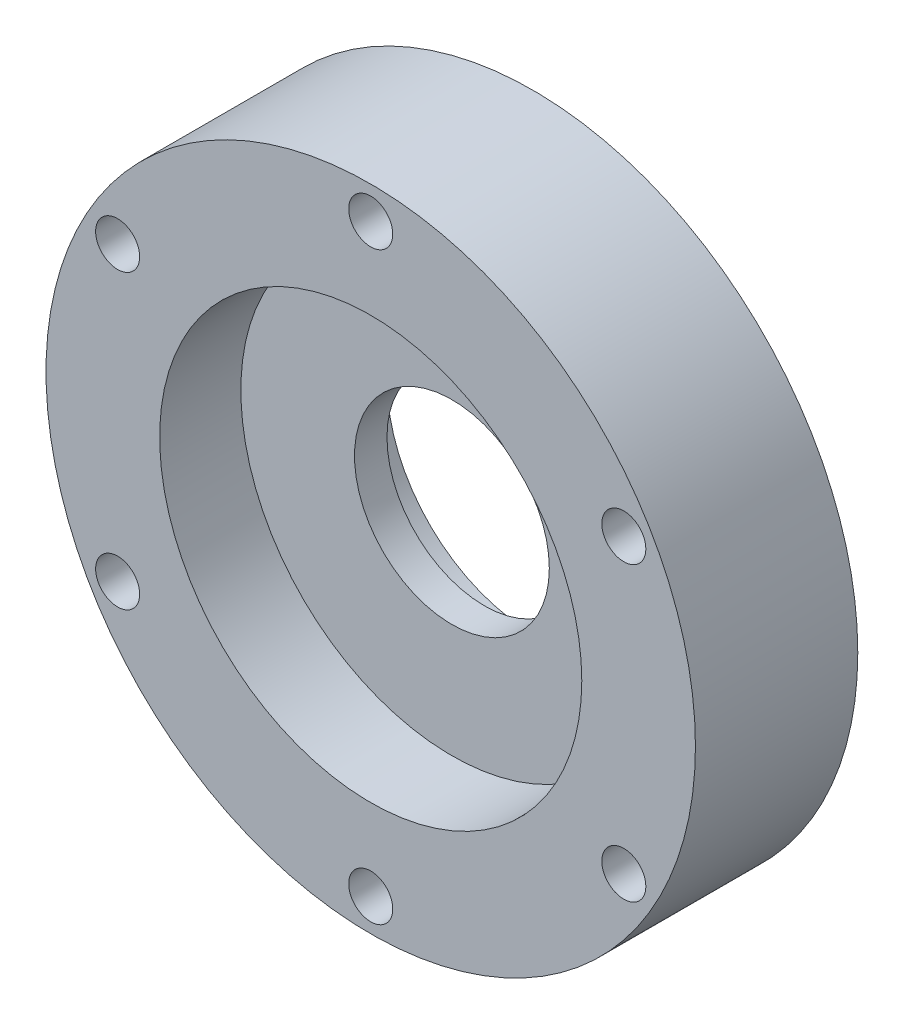
from build123d import *

# Parameters (mm, degrees)
SKETCH1_R             = 31.75
BOSS_EXTRUDE1_DEPTH   = 15.875
SKETCH2_R             = 20.6375
CUT_EXTRUDE1_DEPTH    = 7.9375
SKETCH3_R             = 14.2875
CUT_EXTRUDE2_DEPTH    = 4.7625
SKETCH4_R             = 9.525
CUT_EXTRUDE3_DEPTH    = 46.597466007
F_8_CLEARANCE_HOLE1_D = 4.3053
CUT_EXTRUDE4_DEPTH    = 12.7
CIRPATTERN1_COUNT     = 6
CUT_EXTRUDE5_DEPTH    = 4.7625
CIRPATTERN2_COUNT     = 6


with BuildPart() as part:
    # Sketch1 → Boss-Extrude1 (new body)
    with BuildSketch(Plane.XY):
        Circle(SKETCH1_R)
    extrude(amount=BOSS_EXTRUDE1_DEPTH)

    # Sketch2 → Cut-Extrude1 (cut)
    with BuildSketch(Plane.XY.offset(15.875)):
        Circle(SKETCH2_R)
    extrude(amount=-CUT_EXTRUDE1_DEPTH, mode=Mode.SUBTRACT)

    # Sketch3 → Cut-Extrude2 (cut)
    with BuildSketch(Plane(origin=(0, 0, 0), x_dir=(-1, 0, 0), z_dir=(0, 0, -1))):
        Circle(SKETCH3_R)
    extrude(amount=-CUT_EXTRUDE2_DEPTH, mode=Mode.SUBTRACT)

    # Sketch4 → Cut-Extrude3 (cut, through all)
    with BuildSketch(Plane.XY.offset(7.9375)):
        Circle(SKETCH4_R)
    extrude(amount=-CUT_EXTRUDE3_DEPTH, mode=Mode.SUBTRACT)

    # #8 Clearance Hole1 (through all)
    with Locations(Plane.XY.offset(15.875)):
        with Locations((0, 28.575), (24.746675913, 14.2875), (24.746675913, -14.2875), (0, -28.575), (-24.746675913, -14.2875), (-24.746675913, 14.2875)):
            Hole(F_8_CLEARANCE_HOLE1_D / 2)

    # Sketch8 → Cut-Extrude4 (cut)
    with BuildSketch(Plane(origin=(0, 0, 0), x_dir=(-1, 0, 0), z_dir=(0, 0, -1))):
        with BuildLine():
            ThreePointArc((1.583266667, 25.822929568), (1.000695836, 25.241701981), (0.7874, 24.446894352))
            Line((0.7874, 24.446894352), (0.7874, 23.693775686))
            ThreePointArc((0.7874, 23.693775686), (1.197721204, 22.628690556), (2.216573333, 22.11419064))
            ThreePointArc((2.216573333, 22.11419064), (11.1125, 19.247414599), (18.043164212, 12.976704136))
            ThreePointArc((18.043164212, 12.976704136), (18.998160274, 12.351602268), (20.125711655, 12.528796246))
            Line((20.125711655, 12.528796246), (20.777931553, 12.905355579))
            ThreePointArc((20.777931553, 12.905355579), (21.359607232, 13.487479006), (21.571679673, 14.282613938))
            ThreePointArc((21.571679673, 14.282613938), (21.932102472, 15.756785998), (22.935561781, 16.895275029))
            ThreePointArc((22.935561781, 16.895275029), (23.602704974, 17.982898478), (23.253893866, 19.210227129))
            ThreePointArc((23.253893866, 19.210227129), (15.08125, 26.121491242), (5.009597773, 29.743576389))
            ThreePointArc((5.009597773, 29.743576389), (3.772294429, 29.431991344), (3.163956488, 28.310416667))
            ThreePointArc((3.163956488, 28.310416667), (2.679725721, 26.872150898), (1.583266667, 25.822929568))
        make_face()
    cut_extrude4 = extrude(amount=-CUT_EXTRUDE4_DEPTH, mode=Mode.SUBTRACT)

    # CirPattern1: Cut-Extrude4 ×6 about axis
    cirpattern1_axis = Axis((0, 0, 0), (0, 0, 1))
    for i in range(1, CIRPATTERN1_COUNT):
        add(cut_extrude4.rotate(cirpattern1_axis, i * 360 / CIRPATTERN1_COUNT), mode=Mode.SUBTRACT)

    # Sketch9 → Cut-Extrude5 (cut)
    with BuildSketch(Plane(origin=(0, 0, 0), x_dir=(-1, 0, 0), z_dir=(0, 0, -1))):
        with BuildLine():
            ThreePointArc((1.583266667, 25.822929568), (1.000695836, 25.241701981), (0.7874, 24.446894352))
            Line((0.7874, 24.446894352), (0.7874, 17.300253069))
            ThreePointArc((0.7874, 17.300253069), (1.178468326, 16.256841597), (2.159, 15.72750279))
            ThreePointArc((2.159, 15.72750279), (7.9375, 13.748153285), (12.540916954, 9.733500242))
            ThreePointArc((12.540916954, 9.733500242), (13.489603645, 9.149004306), (14.588758649, 9.332034937))
            Line((14.588758649, 9.332034937), (20.777931553, 12.905355579))
            ThreePointArc((20.777931553, 12.905355579), (21.359607232, 13.487479006), (21.571679673, 14.282613938))
            ThreePointArc((21.571679673, 14.282613938), (21.932102472, 15.756785998), (22.935561781, 16.895275029))
            ThreePointArc((22.935561781, 16.895275029), (23.602704974, 17.982898478), (23.253893866, 19.210227129))
            ThreePointArc((23.253893866, 19.210227129), (15.08125, 26.121491242), (5.009597773, 29.743576389))
            ThreePointArc((5.009597773, 29.743576389), (3.772294429, 29.431991344), (3.163956488, 28.310416667))
            ThreePointArc((3.163956488, 28.310416667), (2.679725721, 26.872150898), (1.583266667, 25.822929568))
        make_face()
    cut_extrude5 = extrude(amount=-CUT_EXTRUDE5_DEPTH, mode=Mode.SUBTRACT)

    # CirPattern2: Cut-Extrude5 ×6 about axis
    cirpattern2_axis = Axis((0, 0, 0), (0, 0, 1))
    for i in range(1, CIRPATTERN2_COUNT):
        add(cut_extrude5.rotate(cirpattern2_axis, i * 360 / CIRPATTERN2_COUNT), mode=Mode.SUBTRACT)


solid = part.part
